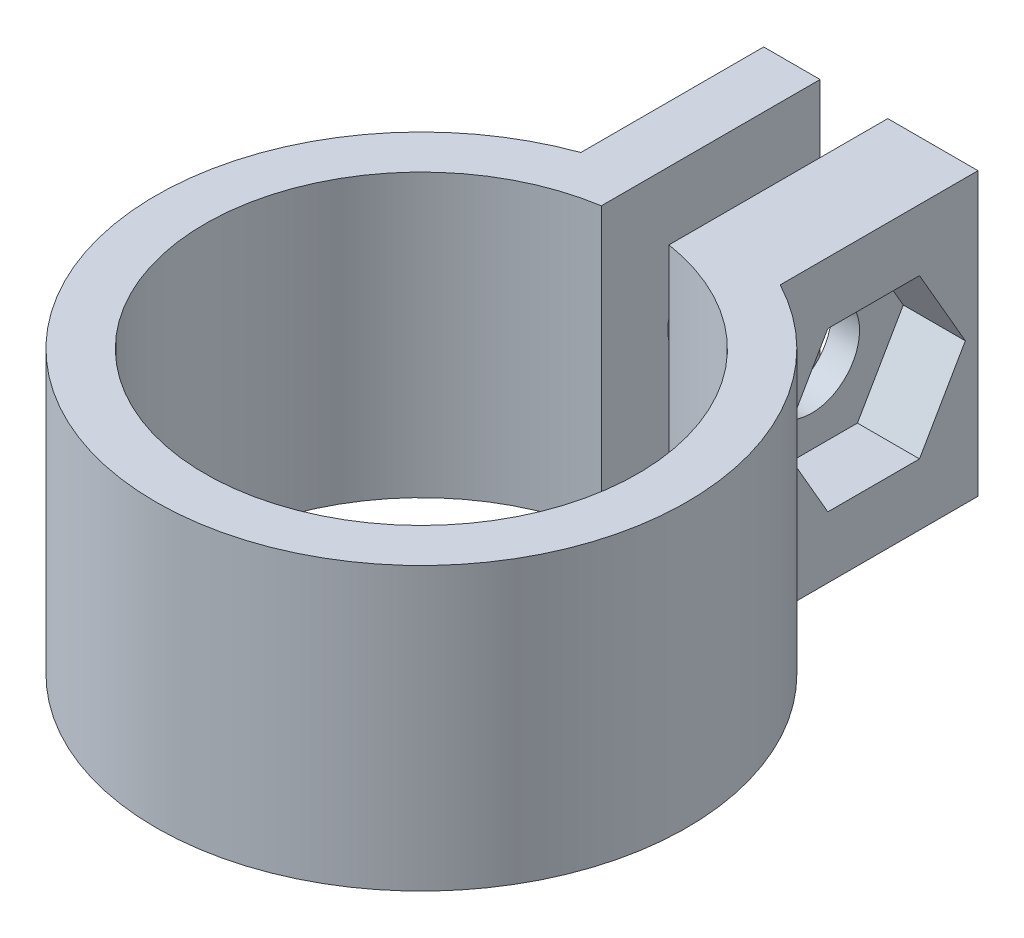
from build123d import *

# Parameters (mm, degrees)
SKETCH1_R            = 9.415
SKETCH1_R_2          = 7.675
EXTRUDE_THIN1_DEPTH  = 10
SKETCH2_W            = 2.4
SKETCH2_H            = 11.262029822
CUT_EXTRUDE1_DEPTH   = 10
BOSS_EXTRUDE1_DEPTH  = 2
SKETCH5_R            = 1.7
CUT_EXTRUDE2_DEPTH   = 10
MOVE_START           = 3.2
MOVE_FACE1_OUTLINE_W = 10
MOVE_FACE1_OUTLINE_H = 8.338213159
MOVE_FACE1_OUTLINE_R = 1.7
MOVE_FACE1_DEPTH     = 1.2
CUT_EXTRUDE3_DEPTH   = 2.2
SKETCH8_R            = 3.25
CUT_EXTRUDE4_DEPTH   = 3


# Read off the part's stored shape, not the designer's step: Move Face1
with BuildPart() as part:
    # Sketch1 → Extrude-Thin1 (new body)
    with BuildSketch(Plane(origin=(0, 0, 0), x_dir=(1, 0, 0), z_dir=(0, 1, 0))):
        Circle(SKETCH1_R)
        Circle(SKETCH1_R_2, mode=Mode.SUBTRACT)
    extrude(amount=EXTRUDE_THIN1_DEPTH)

    # Sketch2 → Cut-Extrude1 (cut)
    with BuildSketch(Plane(origin=(0, 10, 0), x_dir=(1, 0, 0), z_dir=(0, 1, 0))):
        with Locations((0, 7.042452335)):
            Rectangle(SKETCH2_W, SKETCH2_H)
    extrude(amount=-CUT_EXTRUDE1_DEPTH, mode=Mode.SUBTRACT)

    # Sketch4 → Boss-Extrude1 (add)
    with BuildSketch(Plane(origin=(-1.2, 0, 0), x_dir=(0, 0, -1), z_dir=(1, 0, 0))):
        Polygon((9.338213159, 10), (8.459410822, 10), (8.459410822, 0), (9.338213159, 0), (15.338213159, 0), (15.338213159, 10), align=None)
    boss_extrude1 = extrude(amount=-BOSS_EXTRUDE1_DEPTH)

    # Mirror1: Boss-Extrude1 across plane
    add(boss_extrude1.mirror(Plane(origin=(0, 0, 0), x_dir=(0, 0, 1), z_dir=(1, 0, 0))))

    # Sketch5 → Cut-Extrude2 (cut)
    with BuildSketch(Plane(origin=(3.2, 0, 0), x_dir=(0, 0, -1), z_dir=(1, 0, 0))):
        with Locations((11.638213159, 5)):
            Circle(SKETCH5_R)
    extrude(amount=-CUT_EXTRUDE2_DEPTH, mode=Mode.SUBTRACT)

    # Move Face1 outline → Move Face1 (add)
    with BuildSketch(Plane.YZ.offset(MOVE_START)):
        with Locations((5, -11.169106579)):
            Rectangle(MOVE_FACE1_OUTLINE_W, MOVE_FACE1_OUTLINE_H)
        with Locations((5, -11.638213159)):
            Circle(MOVE_FACE1_OUTLINE_R, mode=Mode.SUBTRACT)
    extrude(amount=MOVE_FACE1_DEPTH)

    # Sketch7 → Cut-Extrude3 (cut)
    with BuildSketch(Plane(origin=(4.4, 0, 0), x_dir=(0, 0, -1), z_dir=(1, 0, 0))):
        Polygon((14.888213159, 5), (13.263213159, 7.814582562), (10.013213159, 7.814582562), (8.388213159, 5), (10.013213159, 2.185417438), (13.263213159, 2.185417438), align=None)
    extrude(amount=-CUT_EXTRUDE3_DEPTH, mode=Mode.SUBTRACT)

    # Sketch8 → Cut-Extrude4 (cut)
    with BuildSketch(Plane.ZY.offset(3.2)):
        with Locations((-11.638213159, 5)):
            Circle(SKETCH8_R)
    extrude(amount=CUT_EXTRUDE4_DEPTH, mode=Mode.SUBTRACT)


solid = part.part
